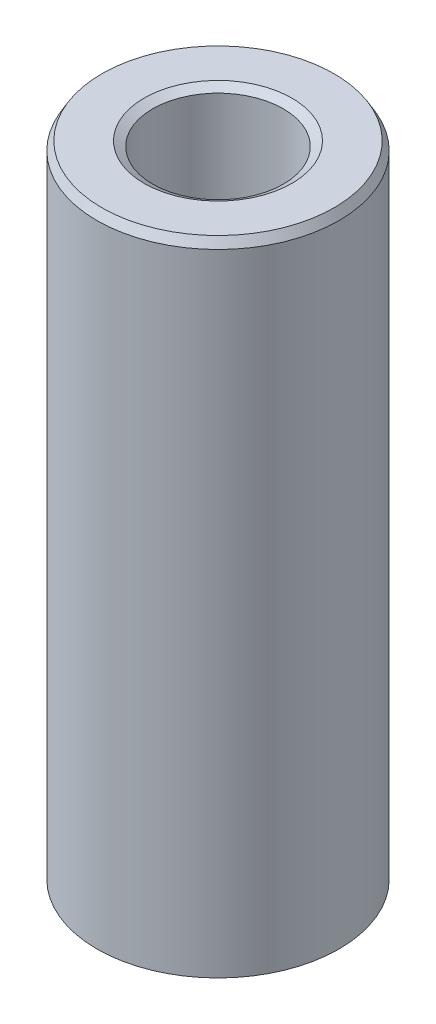
from build123d import *
from OCP.BRepFilletAPI import BRepFilletAPI_MakeChamfer

# Parameters (mm, degrees)
SKETCH1_R           = 35
BOSS_EXTRUDE1_DEPTH = 186.292931904
SKETCH2_R           = 18.881983148
CUT_EXTRUDE1_DEPTH  = 193.756469353
CHAMFER1_SIZE       = 2.484345239
CHAMFER1_SIZE2      = 1.434337392


with BuildPart() as part:
    # Sketch1 → Boss-Extrude1 (new body)
    with BuildSketch(Plane(origin=(0, 0, 0), x_dir=(1, 0, 0), z_dir=(0, 1, 0))):
        Circle(SKETCH1_R)
    extrude(amount=BOSS_EXTRUDE1_DEPTH)

    # Sketch2 → Cut-Extrude1 (cut, through all)
    with BuildSketch(Plane(origin=(0, 0, 0), x_dir=(1, 0, 0), z_dir=(0, 1, 0))):
        Circle(SKETCH2_R)
    extrude(amount=CUT_EXTRUDE1_DEPTH, mode=Mode.SUBTRACT)

    # Chamfer1: one chamfer whose edges measure the first distance from different faces: ONE call of the kernel's chamfer builder (chamfer() names one face for all edges)
    chamfer1_edges_1 = [part.edges().sort_by_distance(p)[0] for p in [
        (-18.881983148, 186.292931904, 0),
    ]]
    chamfer1_side_1 = [part.faces().sort_by_distance(p)[0] for p in [
        (-34.010050506, 186.292931904, 0),
    ]]
    chamfer1_edges_2 = [part.edges().sort_by_distance(p)[0] for p in [
        (-18.881983148, 0, 0),
    ]]
    chamfer1_side_2 = [part.faces().sort_by_distance(p)[0] for p in [
        (-18.881983148, 93.146465952, 0),
    ]]
    chamfer1_edges_3 = [part.edges().sort_by_distance(p)[0] for p in [
        (-35, 0, 0),
    ]]
    chamfer1_side_3 = [part.faces().sort_by_distance(p)[0] for p in [
        (-34.010050506, 0, 0),
    ]]
    chamfer1_edges_4 = [part.edges().sort_by_distance(p)[0] for p in [
        (-35, 186.292931904, 0),
    ]]
    chamfer1_side_4 = [part.faces().sort_by_distance(p)[0] for p in [
        (-35, 93.146465952, 0),
    ]]
    chamfer1 = BRepFilletAPI_MakeChamfer(part.part.solid().wrapped)
    for e in chamfer1_edges_1:
        chamfer1.Add(CHAMFER1_SIZE, CHAMFER1_SIZE2, e.wrapped, chamfer1_side_1[0].wrapped)  # the first distance lies on this face
    for e in chamfer1_edges_2:
        chamfer1.Add(CHAMFER1_SIZE, CHAMFER1_SIZE2, e.wrapped, chamfer1_side_2[0].wrapped)  # the first distance lies on this face
    for e in chamfer1_edges_3:
        chamfer1.Add(CHAMFER1_SIZE, CHAMFER1_SIZE2, e.wrapped, chamfer1_side_3[0].wrapped)  # the first distance lies on this face
    for e in chamfer1_edges_4:
        chamfer1.Add(CHAMFER1_SIZE, CHAMFER1_SIZE2, e.wrapped, chamfer1_side_4[0].wrapped)  # the first distance lies on this face
    add(Compound.cast(chamfer1.Shape()), mode=Mode.REPLACE)


solid = part.part
